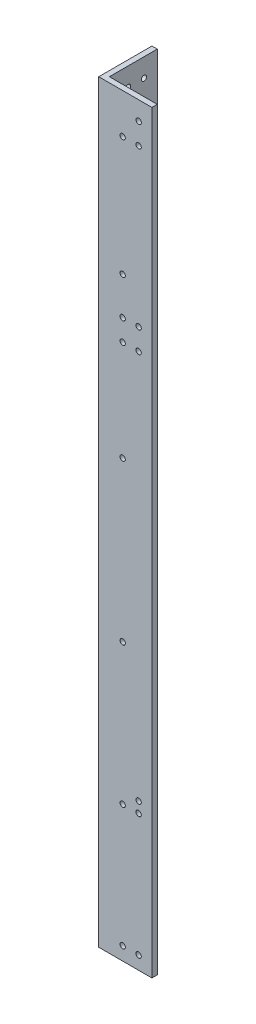
from build123d import *

# Parameters (mm, degrees)
BOSS_EXTRUDE1_DEPTH               = 450
RIGHTSIDEHOLES_SKETCH3_R          = 1.5875
RIGHTSIDEHOLES_CUT_EXTRUDE1_DEPTH = 3.175
FRONTSIDEHOLES_SKETCH4_R          = 1.5875
FRONTSIDEHOLES_CUT_EXTRUDE2_DEPTH = 3.175


with BuildPart() as part:
    # Sketch2 → Boss-Extrude1 (new body)
    with BuildSketch(Plane(origin=(0, 0, 0), x_dir=(1, 0, 0), z_dir=(0, 1, 0))):
        Polygon((0, 31.75), (3.175, 31.75), (3.175, 3.175), (31.75, 3.175), (31.75, 0), (0, 0), align=None)
    extrude(amount=BOSS_EXTRUDE1_DEPTH)

    # RightSideHoles-Sketch3 → RightSideHoles-Cut-Extrude1 (cut)
    with BuildSketch(Plane.XY):
        with Locations((14.2875, 81.1125)):
            Circle(RIGHTSIDEHOLES_SKETCH3_R)
        with Locations((23.8125, 81.1125)):
            Circle(RIGHTSIDEHOLES_SKETCH3_R)
        with Locations((23.8125, 87.4625)):
            Circle(RIGHTSIDEHOLES_SKETCH3_R)
        with Locations((14.2875, 426.1875)):
            Circle(RIGHTSIDEHOLES_SKETCH3_R)
        with Locations((23.8125, 438.8875)):
            Circle(RIGHTSIDEHOLES_SKETCH3_R)
        with Locations((23.8125, 426.1875)):
            Circle(RIGHTSIDEHOLES_SKETCH3_R)
        with Locations((14.2875, 332.602644)):
            Circle(RIGHTSIDEHOLES_SKETCH3_R)
        with Locations((23.8125, 332.602644)):
            Circle(RIGHTSIDEHOLES_SKETCH3_R)
        with Locations((14.2875, 319.902644)):
            Circle(RIGHTSIDEHOLES_SKETCH3_R)
        with Locations((23.8125, 319.902644)):
            Circle(RIGHTSIDEHOLES_SKETCH3_R)
        with Locations((14.2875, 7.9375)):
            Circle(RIGHTSIDEHOLES_SKETCH3_R)
        with Locations((23.8125, 7.9375)):
            Circle(RIGHTSIDEHOLES_SKETCH3_R)
        with Locations((14.2875, 165)):
            Circle(RIGHTSIDEHOLES_SKETCH3_R)
        with Locations((14.2875, 260)):
            Circle(RIGHTSIDEHOLES_SKETCH3_R)
        with Locations((14.2875, 355)):
            Circle(RIGHTSIDEHOLES_SKETCH3_R)
    extrude(amount=-RIGHTSIDEHOLES_CUT_EXTRUDE1_DEPTH, mode=Mode.SUBTRACT)

    # FrontSideHoles-Sketch4 → FrontSideHoles-Cut-Extrude2 (cut)
    with BuildSketch(Plane.ZY):
        with Locations((-23.8125, 81.1125)):
            Circle(FRONTSIDEHOLES_SKETCH4_R)
        with Locations((-23.8125, 87.4625)):
            Circle(FRONTSIDEHOLES_SKETCH4_R)
        with Locations((-14.2875, 87.4625)):
            Circle(FRONTSIDEHOLES_SKETCH4_R)
        with Locations((-23.8125, 438.8875)):
            Circle(FRONTSIDEHOLES_SKETCH4_R)
        with Locations((-14.2875, 438.8875)):
            Circle(FRONTSIDEHOLES_SKETCH4_R)
        with Locations((-23.8125, 426.1875)):
            Circle(FRONTSIDEHOLES_SKETCH4_R)
        with Locations((-14.2875, 338.177644)):
            Circle(FRONTSIDEHOLES_SKETCH4_R)
        with Locations((-14.2875, 319.652644)):
            Circle(FRONTSIDEHOLES_SKETCH4_R)
        with Locations((-14.2875, 165)):
            Circle(FRONTSIDEHOLES_SKETCH4_R)
        with Locations((-14.2875, 260)):
            Circle(FRONTSIDEHOLES_SKETCH4_R)
        with Locations((-14.2875, 355)):
            Circle(FRONTSIDEHOLES_SKETCH4_R)
        with Locations((-23.8125, 7.9375)):
            Circle(FRONTSIDEHOLES_SKETCH4_R)
        with Locations((-14.2875, 7.9375)):
            Circle(FRONTSIDEHOLES_SKETCH4_R)
    extrude(amount=-FRONTSIDEHOLES_CUT_EXTRUDE2_DEPTH, mode=Mode.SUBTRACT)


solid = part.part
